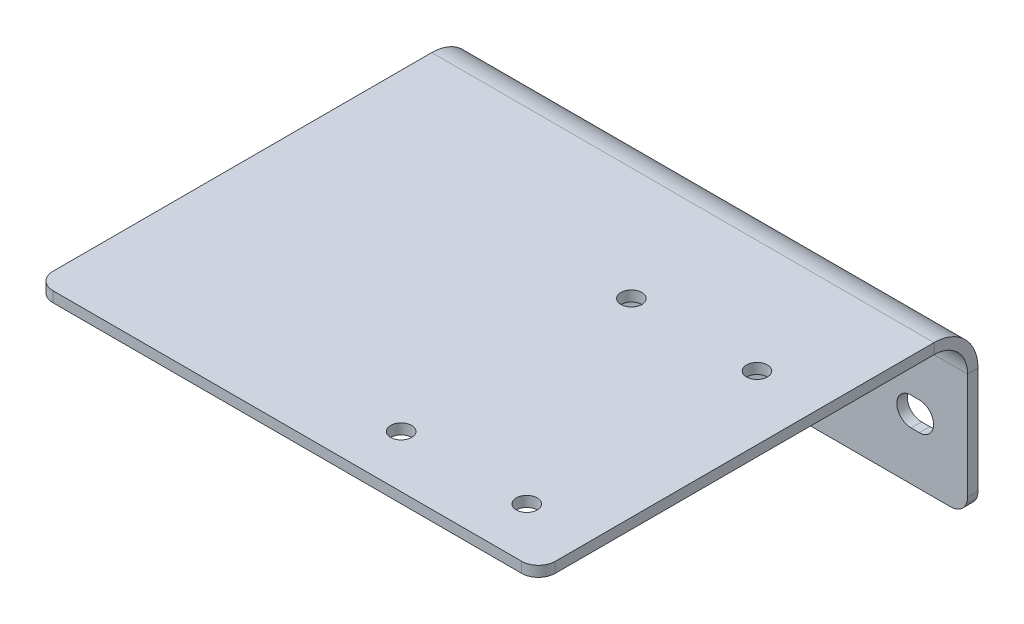
from build123d import *

# Parameters (mm, degrees)
SKETCH2_W                    = 76.2
SKETCH2_H                    = 1.5875
BASE_FLANGE1_DEPTH           = 25.4
EDGE_FLANGE1_STRIP_W         = 16.51
EDGE_FLANGE1_STRIP_H         = 1.5875
EDGE_FLANGE1_STRIP_CUT_DEPTH = 76.2
EDGE_FLANGE1_DEPTH           = 76.2
FILLET1_R                    = 2.54
CUT_EXTRUDE1_DEPTH           = 104.382699985
SKETCH11_R                   = 1.5875
CUT_EXTRUDE2_DEPTH           = 105.014570043


# Sheet-metal steps are written as plain solids
with BuildPart() as part:
    # Sketch2 → Base-Flange1 (new body)
    with BuildSketch(Plane(origin=(0, 0, 0), x_dir=(1, 0, 0), z_dir=(0, 1, 0))):
        with Locations((38.1, -0.79375)):
            Rectangle(SKETCH2_W, SKETCH2_H)
    extrude(amount=BASE_FLANGE1_DEPTH)

    # Edge-Flange1 strip (across the edge) → Edge-Flange1 strip cut (cut)
    with BuildSketch(Plane(origin=(76.2, 25.4, 1.5875), x_dir=(0, -1, 0), z_dir=(-1, 0, 0))):
        with Locations((-1.5875, -0.79375)):
            Rectangle(EDGE_FLANGE1_STRIP_W, EDGE_FLANGE1_STRIP_H)
    extrude(amount=EDGE_FLANGE1_STRIP_CUT_DEPTH, mode=Mode.SUBTRACT)

    # Edge-Flange1 section (across the edge) → Edge-Flange1 (add)
    with BuildSketch(Plane(origin=(76.2, 25.4, 1.5875), x_dir=(0, -1, 0), z_dir=(-1, 0, 0))):
        with BuildLine():
            Line((0, 5.08), (0, 65.0875))
            Line((0, 65.0875), (1.5875, 65.0875))
            Line((1.5875, 65.0875), (1.5875, 5.08))
            ThreePointArc((1.5875, 5.08), (3.075397552, 1.487897552), (6.6675, 0))
            Line((6.6675, 0), (6.6675, -1.5875))
            ThreePointArc((6.6675, -1.5875), (1.952865536, 0.365365536), (0, 5.08))
        make_face()
    extrude(amount=EDGE_FLANGE1_DEPTH)

    # Fillet1
    fillet1_edges = [part.edges().sort_by_distance(p)[0] for p in [
        (76.2, 24.60625, 66.675),
        (0, 24.60625, 66.675),
        (0, 0, 0.79375),
        (76.2, 0, 0.79375),
    ]]
    fillet(fillet1_edges, radius=FILLET1_R)

    # Sketch10 → Cut-Extrude1 (cut, through all)
    with BuildSketch(Plane.XY.offset(1.5875)):
        with BuildLine():
            Line((7.3025, 11.67765), (8.5725, 11.67765))
            ThreePointArc((8.5725, 11.67765), (10.72515, 9.525), (8.5725, 7.37235))
            Line((8.5725, 7.37235), (7.3025, 7.37235))
            ThreePointArc((7.3025, 7.37235), (5.14985, 9.525), (7.3025, 11.67765))
        make_face()
        with BuildLine():
            Line((67.6275, 11.67765), (68.8975, 11.67765))
            ThreePointArc((68.8975, 11.67765), (71.05015, 9.525), (68.8975, 7.37235))
            Line((68.8975, 7.37235), (67.6275, 7.37235))
            ThreePointArc((67.6275, 7.37235), (65.47485, 9.525), (67.6275, 11.67765))
        make_face()
    extrude(amount=-CUT_EXTRUDE1_DEPTH, mode=Mode.SUBTRACT)

    # Sketch11 → Cut-Extrude2 (cut, through all)
    with BuildSketch(Plane.XZ.offset(-23.8125)):
        with Locations(Location((66.4972, 58.7502, 0), (0, 0, 270))):
            Circle(SKETCH11_R)
        with Locations(Location((66.4972, 23.8252, 0), (0, 0, 270))):
            Circle(SKETCH11_R)
        with Locations(Location((47.4472, 23.8252, 0), (0, 0, 270))):
            Circle(SKETCH11_R)
        with Locations(Location((47.4472, 58.7502, 0), (0, 0, 270))):
            Circle(SKETCH11_R)
    extrude(amount=-CUT_EXTRUDE2_DEPTH, mode=Mode.SUBTRACT)


solid = part.part
